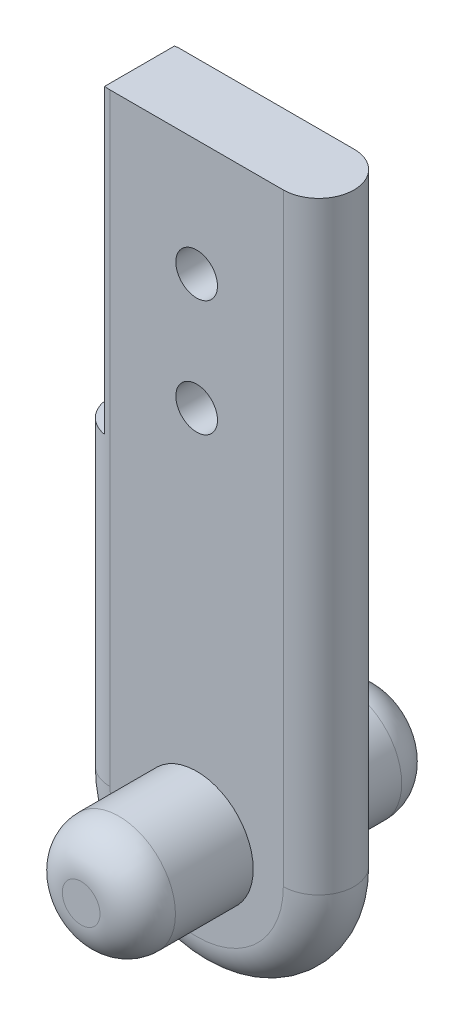
from build123d import *

# Parameters (mm, degrees)
SKETCH1_R             = 4.5640625
BOSS_EXTRUDE1_DEPTH   = 2.9765625
SKETCH2_R             = 4.7625
BOSS_EXTRUDE2_DEPTH   = 12.7
FILLET1_R             = 3.175
FILLET2_R             = 2.976563
SKETCH3_W             = 2.495765829
SKETCH3_H             = 5.953125
CUT_EXTRUDE1_DEPTH    = 25.4
F_6_32_TAPPED_HOLE1_D = 3.5052


with BuildPart() as part:
    # Sketch1 → Boss-Extrude1 (new, symmetric)
    with BuildSketch(Plane.XY):
        with BuildLine():
            Line((34.572359171, 0), (34.572359171, 50.8))
            Line((34.572359171, 50.8), (55.121390829, 50.8))
            Line((55.121390829, 50.8), (55.121390829, 0))
            ThreePointArc((55.121390829, 0), (44.846875, -10.274515829), (34.572359171, 0))
        make_face()
        with Locations((44.846875, 0)):
            Circle(SKETCH1_R, mode=Mode.SUBTRACT)
    extrude(amount=BOSS_EXTRUDE1_DEPTH, both=True)

    # Sketch2 → Boss-Extrude2 (add, symmetric)
    with BuildSketch(Plane.XY):
        with Locations((44.846875, 0)):
            Circle(SKETCH2_R)
    extrude(amount=BOSS_EXTRUDE2_DEPTH, both=True)

    # Fillet1
    fillet1_edges = [part.edges().sort_by_distance(p)[0] for p in [
        (40.084375, 0, -12.7),
        (40.084375, 0, 12.7),
    ]]
    fillet(fillet1_edges, radius=FILLET1_R)

    # Fillet2
    fillet2_edges = [part.edges().sort_by_distance(p)[0] for p in [
        (34.572359171, 25.4, 2.9765625),
        (44.846875, -10.274515829, 2.9765625),
        (34.572359171, 25.4, -2.9765625),
        (55.121390829, 25.4, -2.9765625),
        (55.121390829, 25.4, 2.9765625),
    ]]
    fillet(fillet2_edges, radius=FILLET2_R - 0.0001)  # a hair under: the kernel refuses the full size

    # Sketch3 → Cut-Extrude1 (cut)
    with BuildSketch(Plane(origin=(0, 50.8, 0), x_dir=(1, 0, 0), z_dir=(0, 1, 0))):
        with Locations((35.820242085, 0)):
            Rectangle(SKETCH3_W, SKETCH3_H)
    extrude(amount=-CUT_EXTRUDE1_DEPTH, mode=Mode.SUBTRACT)

    # #6-32 Tapped Hole1 (through all)
    with Locations(Plane(origin=(0, 0, -2.9765625), x_dir=(-1, 0, 0), z_dir=(0, 0, -1))):
        with Locations((-44.846875, 41.021), (-44.846875, 31.242)):
            Hole(F_6_32_TAPPED_HOLE1_D / 2)


solid = part.part
